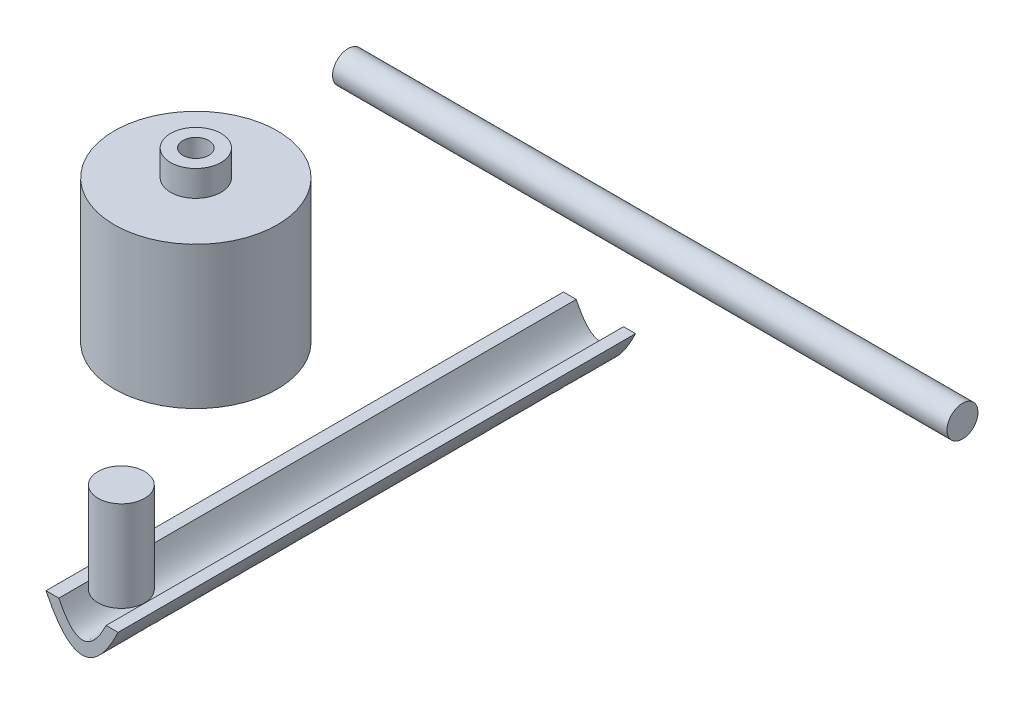
from build123d import *

# Parameters (mm, degrees)
BOSS_EXTRUDE3_OUTLINE_R = 6.3
BOSS_EXTRUDE3_DEPTH     = 11
SKETCH4_R               = 1.95
BOSS_EXTRUDE8_DEPTH     = 2
SKETCH11_R              = 1
CUT_EXTRUDE3_DEPTH      = 41.160605774
SKETCH7_R               = 1.2
BOSS_EXTRUDE10_DEPTH    = 47.5
BOSS_EXTRUDE14_DEPTH    = 40
SKETCH17_R              = 1.8
BOSS_EXTRUDE15_DEPTH    = 7


# Read off the part's stored shape, not the designer's step: Boss-Extrude3
with BuildPart() as part:
    # Boss-Extrude3 outline → Boss-Extrude3 (new body)
    with BuildSketch(Plane(origin=(0, 0, 0), x_dir=(1, 0, 0), z_dir=(0, 1, 0))):
        with Locations((-17.169079115, 23.584386921)):
            Circle(BOSS_EXTRUDE3_OUTLINE_R)
    extrude(amount=BOSS_EXTRUDE3_DEPTH)

    # Sketch4 → Boss-Extrude8 (add)
    with BuildSketch(Plane(origin=(0, 11, 0), x_dir=(1, 0, 0), z_dir=(0, 1, 0))):
        with Locations(Location((-17.169079115, 23.584386921, 0), (0, 0, 270))):
            Circle(SKETCH4_R)
    extrude(amount=BOSS_EXTRUDE8_DEPTH)

    # Sketch11 → Cut-Extrude3 (cut, through all)
    with BuildSketch(Plane(origin=(0, 0, 0), x_dir=(1, 0, 0), z_dir=(0, 1, 0))):
        with Locations(Location((-17.169079115, 23.584386921, 0), (0, 0, 90))):
            Circle(SKETCH11_R)
    extrude(amount=CUT_EXTRUDE3_DEPTH, mode=Mode.SUBTRACT)


with BuildPart() as body_2:
    # Sketch7 → Boss-Extrude10 (new body)
    with BuildSketch(Plane(origin=(20.260349504, 0, 0), x_dir=(0, 0, -1), z_dir=(1, 0, 0))):
        with Locations((45.425113589, 2.5)):
            Circle(SKETCH7_R)
    extrude(amount=-BOSS_EXTRUDE10_DEPTH)


with BuildPart() as body_3:
    # Sketch13 → Boss-Extrude14 (new body)
    with BuildSketch(Plane.XY.offset(-1.147113589)):
        with BuildLine():
            Line((-6.31477114, 0), (-5.323418525, 0))
            add(Edge.make_bspline(
                [(-5.323418525, 0), (-3.489459234, -3.784444713), (-1.667001085, 0)],
                knots=[0, 0, 0, 1, 1, 1], degree=2))
            Line((-1.667001085, 0), (-0.740022016, 0))
            add(Edge.make_bspline(
                [(-6.31477114, 0), (-3.488031914, -5.818885026), (-0.740022016, 0)],
                knots=[0, 0, 0, 1, 1, 1], degree=2))
        make_face()
    extrude(amount=-BOSS_EXTRUDE14_DEPTH)


with BuildPart() as body_4:
    # Sketch17 → Boss-Extrude15 (new body)
    with BuildSketch(Plane(origin=(0, 0, 0), x_dir=(1, 0, 0), z_dir=(0, 1, 0))):
        with Locations(Location((-3.489650496, 4.147113589, 0), (0, 0, 270))):
            Circle(SKETCH17_R)
    extrude(amount=BOSS_EXTRUDE15_DEPTH)


solid = Compound([part.part, body_2.part, body_3.part, body_4.part])
